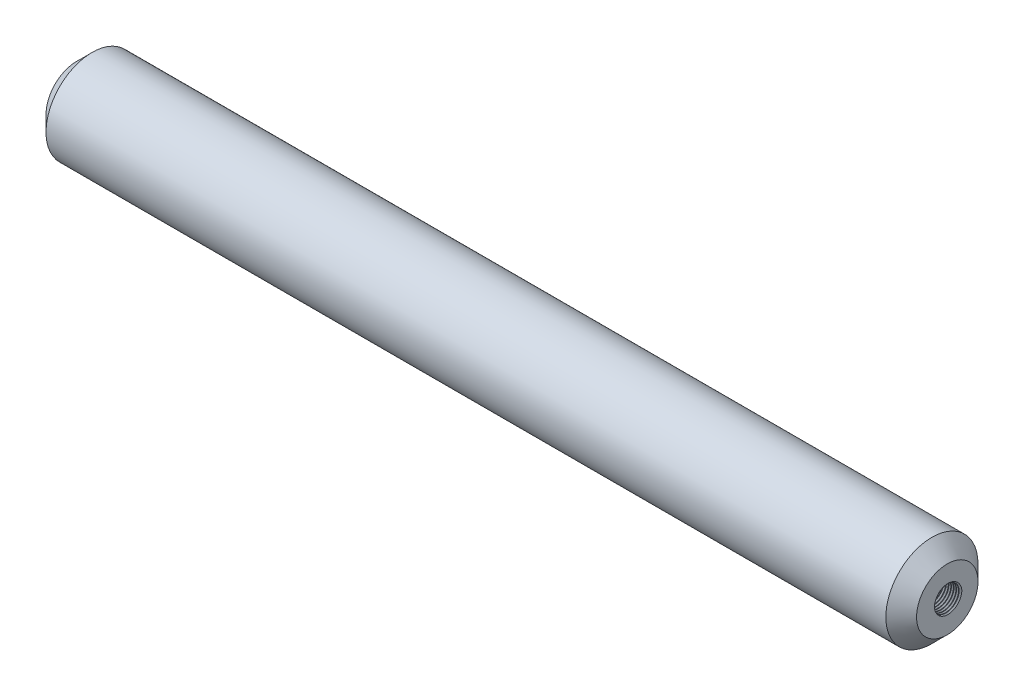
from build123d import *

# Parameters (mm, degrees)
SKETCH1_R           = 9
BOSS_EXTRUDE1_DEPTH = 170
SKETCH2_R           = 2.5
CUT_EXTRUDE1_DEPTH  = 24
CUT_EXTRUDE2_START  = -24
SKETCH3_R           = 2.5
CUT_EXTRUDE2_DEPTH  = 24
CUT_SWEEP5_PITCH    = 0.5
CUT_SWEEP6_PITCH    = 0.5
CHAMFER1_SIZE       = 3


with BuildPart() as part:
    # Sketch1 → Boss-Extrude1 (new body)
    with BuildSketch(Plane(origin=(0, 0, 0), x_dir=(0, 0, -1), z_dir=(1, 0, 0))):
        Circle(SKETCH1_R)
    extrude(amount=-BOSS_EXTRUDE1_DEPTH)

    # Sketch2 → Cut-Extrude1 (cut)
    with BuildSketch(Plane(origin=(0, 0, 0), x_dir=(0, 0, -1), z_dir=(1, 0, 0))):
        Circle(SKETCH2_R)
    extrude(amount=-CUT_EXTRUDE1_DEPTH, mode=Mode.SUBTRACT)

    # Sketch3 → Cut-Extrude2 (cut)
    with BuildSketch(Plane.ZY.offset(170).offset(CUT_EXTRUDE2_START)):
        with Locations(Location((0, 0, 0), (0, 0, 180))):
            Circle(SKETCH3_R)
    extrude(amount=CUT_EXTRUDE2_DEPTH, mode=Mode.SUBTRACT)

    # Cut-Sweep5: arcs per turn and ends read off the stored shape
    # Cut-Sweep5: the profile of 3DSketch6 profile screwed along a right-hand helix through 37 turns, 6 arcs to a turn; built about Z, then put on its axis
    cut_sweep5_z = Axis((0, 0, 0), (0, 0, 1))
    cut_sweep5_corners = [(2.4997, 0, -0.700174018), (2.4997, 0, -0.299828416), (2.847219747, 0, -0.498591157)]
    with BuildLine(mode=Mode.PRIVATE) as cut_sweep5_profile:
        Line(cut_sweep5_corners[0], cut_sweep5_corners[1])
        Line(cut_sweep5_corners[1], cut_sweep5_corners[2])
        Line(cut_sweep5_corners[2], cut_sweep5_corners[0])
    cut_sweep5_cap = Face(cut_sweep5_profile.wire())
    cut_sweep5_turn_angles = [0, 30, 60, 90, 120, 150, 180, 210, 240, 270, 300, 330, 360]
    cut_sweep5_turn_weights = [1, 0.8660254037844387, 1, 0.8660254037844387, 1, 0.8660254037844387, 1, 0.8660254037844387, 1, 0.8660254037844387, 1, 0.8660254037844387, 1]
    cut_sweep5_turn_rails = [Edge.make_bspline([Vector(p[0], p[1], 0).rotate(cut_sweep5_z, cut_sweep5_turn_angles[k]) / cut_sweep5_turn_weights[k] + Vector(0, 0, p[2] + CUT_SWEEP5_PITCH * cut_sweep5_turn_angles[k] / 360) for k in range(13)], [0, 0, 0, 1, 1, 2, 2, 3, 3, 4, 4, 5, 5, 6, 6, 6], 2, cut_sweep5_turn_weights) for p in cut_sweep5_corners]
    cut_sweep5_turn_sides = [Face.make_surface_from_curves(cut_sweep5_turn_rails[p[0]], cut_sweep5_turn_rails[p[1]]) for p in [(0, 1), (1, 2), (2, 0)]]
    cut_sweep5 = Plane(origin=(0, 0, 0), x_dir=(0, 0, -1), z_dir=(-1, 0, 0)) * Solid(Shell([*[p.moved(Location((0, 0, CUT_SWEEP5_PITCH * i))) for i in range(37) for p in cut_sweep5_turn_sides], cut_sweep5_cap, cut_sweep5_cap.rotate(cut_sweep5_z, 13320).moved(Location((0, 0, CUT_SWEEP5_PITCH * 13320 / 360)))]))
    add(cut_sweep5, mode=Mode.SUBTRACT)

    # Cut-Sweep6: arcs per turn and ends read off the stored shape
    # Cut-Sweep6: the profile of 3DSketch8 profile screwed along a right-hand helix through 37 turns, 6 arcs to a turn; built about Z, then put on its axis
    cut_sweep6_z = Axis((0, 0, 0), (0, 0, 1))
    cut_sweep6_corners = [(2.4997, 0, -0.299826795), (2.846410162, 0, -0.5), (2.4997, 0, -0.700173205)]
    with BuildLine(mode=Mode.PRIVATE) as cut_sweep6_profile:
        Line(cut_sweep6_corners[0], cut_sweep6_corners[1])
        Line(cut_sweep6_corners[1], cut_sweep6_corners[2])
        Line(cut_sweep6_corners[2], cut_sweep6_corners[0])
    cut_sweep6_cap = Face(cut_sweep6_profile.wire())
    cut_sweep6_turn_angles = [0, 30, 60, 90, 120, 150, 180, 210, 240, 270, 300, 330, 360]
    cut_sweep6_turn_weights = [1, 0.8660254037844387, 1, 0.8660254037844387, 1, 0.8660254037844387, 1, 0.8660254037844387, 1, 0.8660254037844387, 1, 0.8660254037844387, 1]
    cut_sweep6_turn_rails = [Edge.make_bspline([Vector(p[0], p[1], 0).rotate(cut_sweep6_z, cut_sweep6_turn_angles[k]) / cut_sweep6_turn_weights[k] + Vector(0, 0, p[2] + CUT_SWEEP6_PITCH * cut_sweep6_turn_angles[k] / 360) for k in range(13)], [0, 0, 0, 1, 1, 2, 2, 3, 3, 4, 4, 5, 5, 6, 6, 6], 2, cut_sweep6_turn_weights) for p in cut_sweep6_corners]
    cut_sweep6_turn_sides = [Face.make_surface_from_curves(cut_sweep6_turn_rails[p[0]], cut_sweep6_turn_rails[p[1]]) for p in [(0, 1), (1, 2), (2, 0)]]
    cut_sweep6 = Plane(origin=(-170, 0, 0), x_dir=(0, 0, 1), z_dir=(1, 0, 0)) * Solid(Shell([*[p.moved(Location((0, 0, CUT_SWEEP6_PITCH * i))) for i in range(37) for p in cut_sweep6_turn_sides], cut_sweep6_cap, cut_sweep6_cap.rotate(cut_sweep6_z, 13320).moved(Location((0, 0, CUT_SWEEP6_PITCH * 13320 / 360)))]))
    add(cut_sweep6, mode=Mode.SUBTRACT)

    # Chamfer1
    chamfer1_edges = [part.edges().sort_by_distance(p)[0] for p in [
        (0, 0, 9),
        (-170, 0, 9),
    ]]
    chamfer(chamfer1_edges, length=CHAMFER1_SIZE)


solid = part.part
